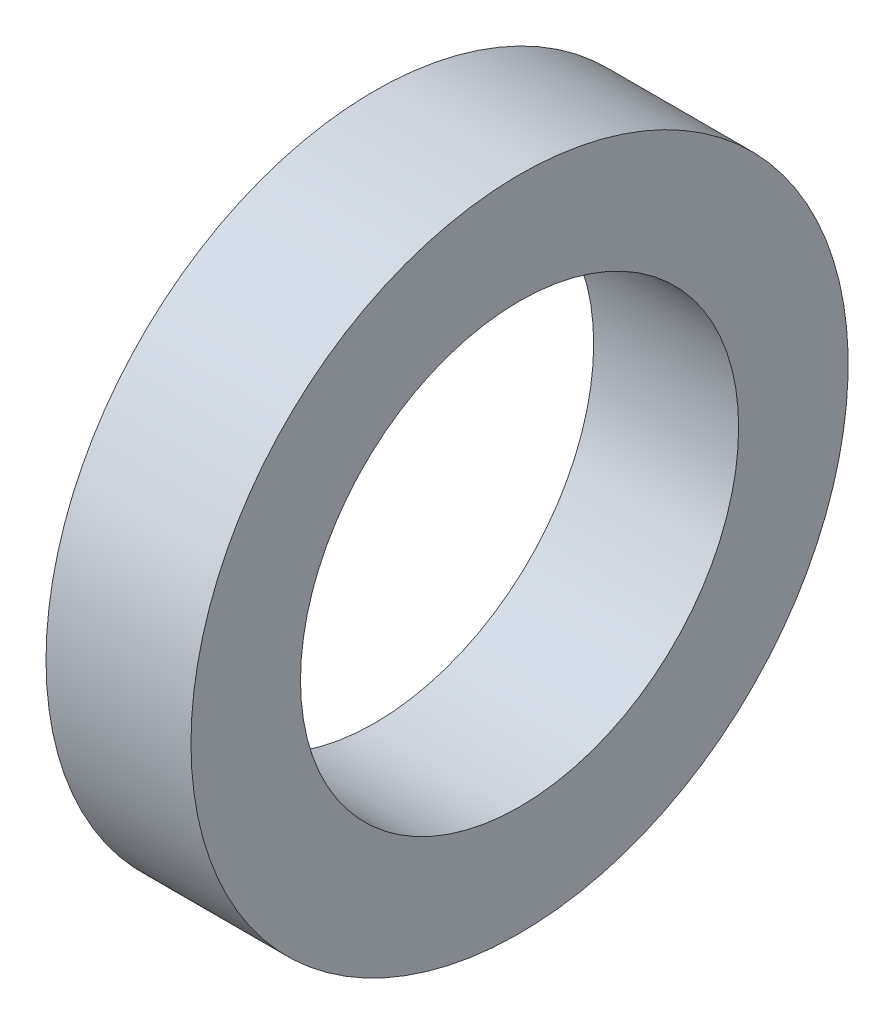
from build123d import *

# Parameters (mm, degrees)
SKETCH3_W = 3.969999934
SKETCH3_H = 3.000000096


with BuildPart() as part:
    # Sketch3 → Revolve1 (revolve)
    with BuildSketch(Plane.XY):
        with Locations((7.984999905, 7.499999986)):
            Rectangle(SKETCH3_W, SKETCH3_H)
    revolve(axis=Axis((0, 0, 0), (1, 0, 0)))


solid = part.part
